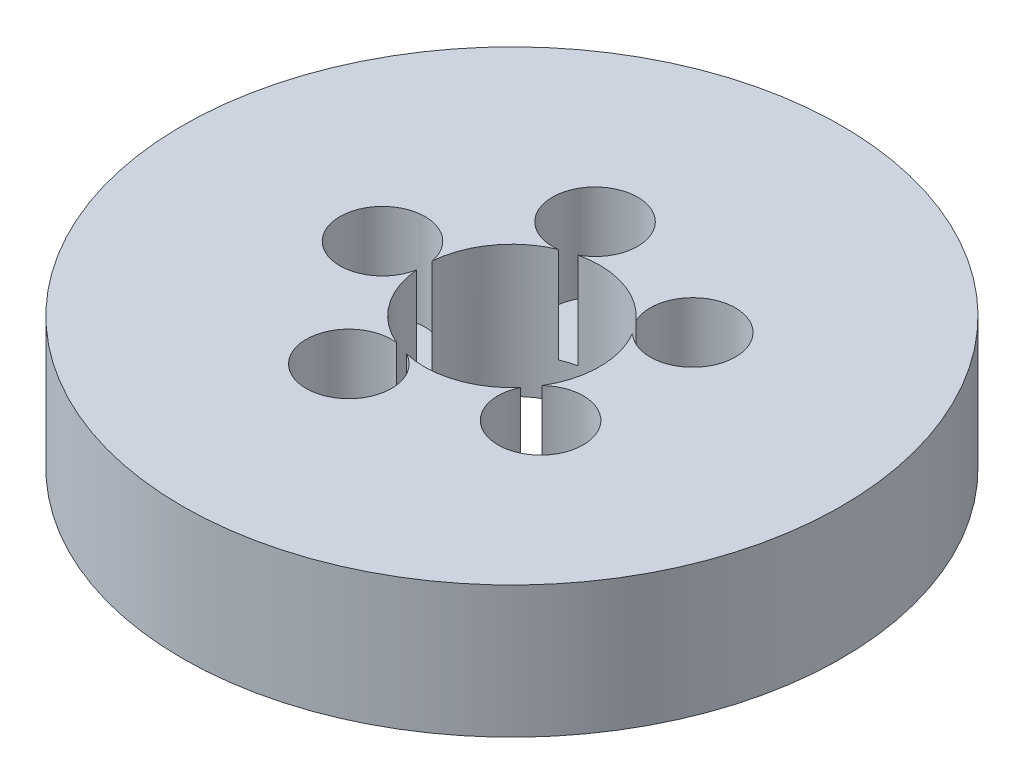
from build123d import *

# Parameters (mm, degrees)
SKETCH1_R           = 75
BOSS_EXTRUDE1_DEPTH = 30
SKETCH2_R           = 20
CUT_EXTRUDE1_DEPTH  = 111.227038425
SKETCH3_R           = 9.70466537
CUT_EXTRUDE2_DEPTH  = 21.790165701
CIRPATTERN1_COUNT   = 5


with BuildPart() as part:
    # Sketch1 → Boss-Extrude1 (new body)
    with BuildSketch(Plane(origin=(0, 0, 0), x_dir=(1, 0, 0), z_dir=(0, 1, 0))):
        Circle(SKETCH1_R)
    extrude(amount=BOSS_EXTRUDE1_DEPTH)

    # Sketch2 → Cut-Extrude1 (cut, through all)
    with BuildSketch(Plane(origin=(0, 0, 0), x_dir=(1, 0, 0), z_dir=(0, 1, 0))):
        Circle(SKETCH2_R)
    extrude(amount=CUT_EXTRUDE1_DEPTH, mode=Mode.SUBTRACT)

    # Sketch3 → Cut-Extrude2 (cut)
    with BuildSketch(Plane(origin=(0, 30, 0), x_dir=(1, 0, 0), z_dir=(0, 1, 0))):
        with Locations((-29.460786428, 0)):
            Circle(SKETCH3_R)
    cut_extrude2 = extrude(amount=-CUT_EXTRUDE2_DEPTH, mode=Mode.SUBTRACT)

    # CirPattern1: Cut-Extrude2 ×5 about axis
    cirpattern1_axis = Axis((0, 0, 0), (0, 1, 0))
    for i in range(1, CIRPATTERN1_COUNT):
        add(cut_extrude2.rotate(cirpattern1_axis, i * 360 / CIRPATTERN1_COUNT), mode=Mode.SUBTRACT)


solid = part.part
